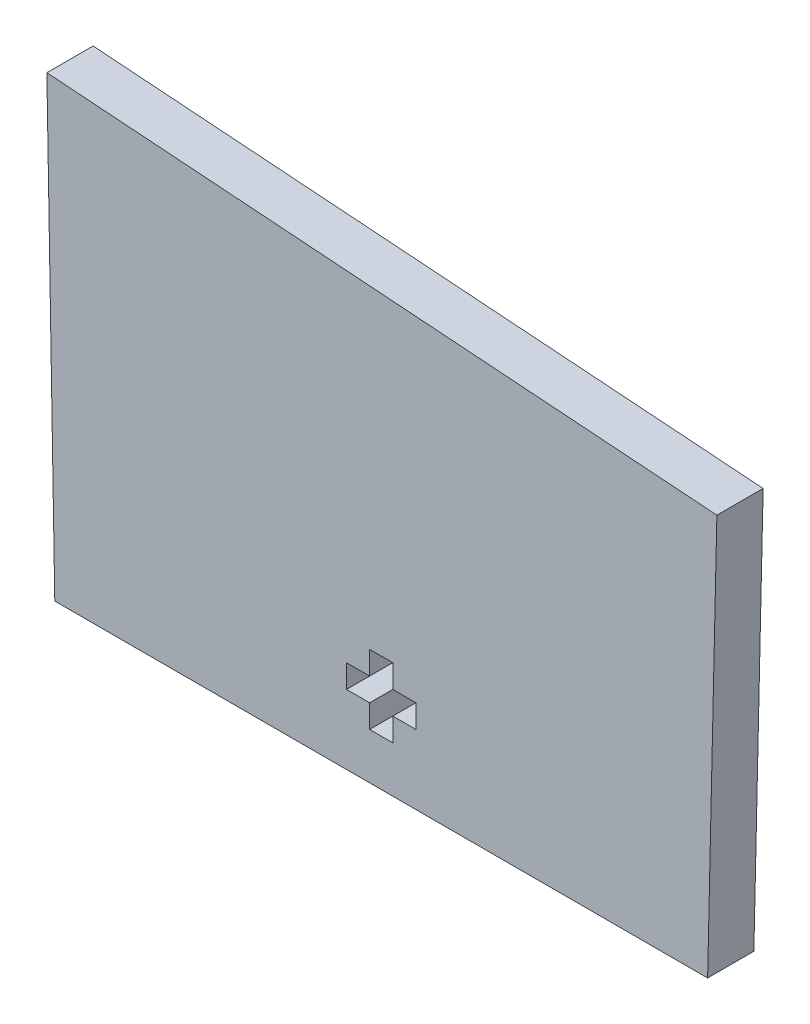
from build123d import *

# Parameters (mm, degrees)
AUFSATZ_LINEAR_AUSTRAGEN1_DEPTH = 2
SCHNITT_LINEAR_AUSTRAGEN1_DEPTH = 35.76432776


with BuildPart() as part:
    # Skizze1 → Aufsatz-Linear austragen1 (new body)
    with BuildSketch(Plane.XY):
        Polygon((0, 0), (-0.342416214, 19.617011779), (28.630950621, 17.53341617), (28.23, 0), align=None)
    extrude(amount=AUFSATZ_LINEAR_AUSTRAGEN1_DEPTH)

    # Skizze5 → Schnitt-Linear austragen1 (cut, through all)
    with BuildSketch(Plane.XY.offset(2)):
        Polygon((12.615, 3), (13.615, 3), (13.615, 2), (14.115, 2), (14.615, 2), (14.615, 3), (15.615, 3), (15.615, 4), (14.615, 4), (14.615, 5), (13.615, 5), (13.615, 4), (12.615, 4), align=None)
    extrude(amount=-SCHNITT_LINEAR_AUSTRAGEN1_DEPTH, mode=Mode.SUBTRACT)


solid = part.part
